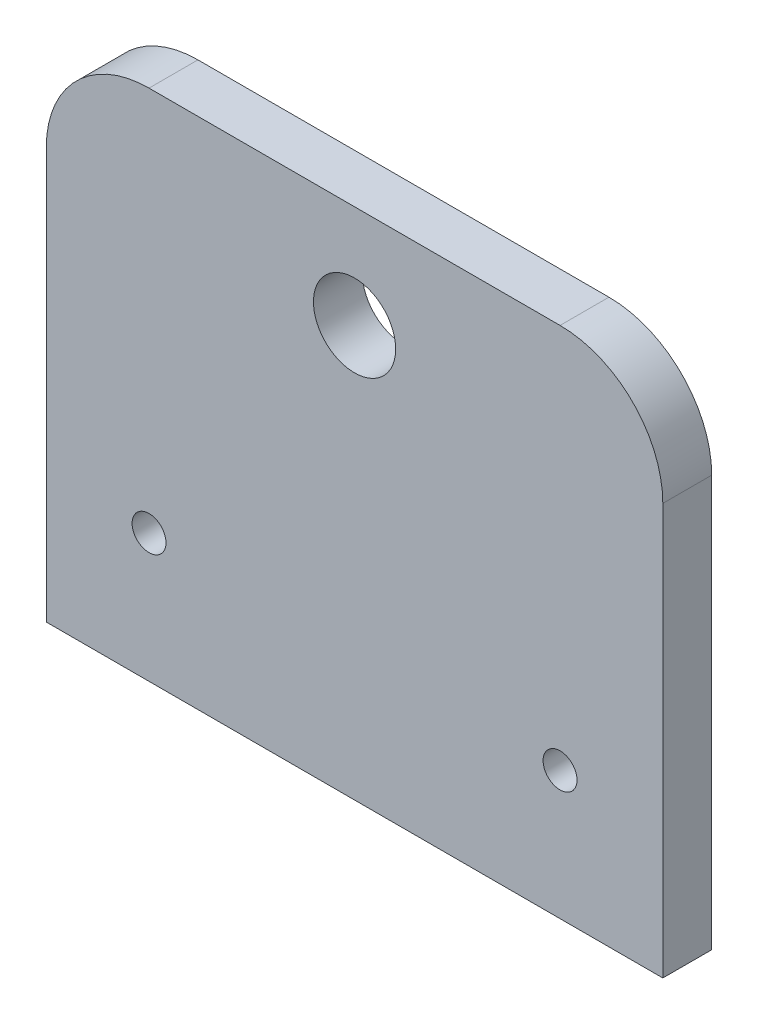
from build123d import *

# Parameters (mm, degrees)
SKETCH1_W           = 60
SKETCH1_H           = 50
BOSS_EXTRUDE1_DEPTH = 4.76
SKETCH2_R           = 1.65
SKETCH2_R_2         = 4
CUT_EXTRUDE1_DEPTH  = 79.247412737
FILLET1_R           = 10


with BuildPart() as part:
    # Sketch1 → Boss-Extrude1 (new body)
    with BuildSketch(Plane.XY):
        with Locations((30, 25)):
            Rectangle(SKETCH1_W, SKETCH1_H)
    extrude(amount=BOSS_EXTRUDE1_DEPTH)

    # Sketch2 → Cut-Extrude1 (cut, through all)
    with BuildSketch(Plane.XY.offset(4.76)):
        with Locations((10, 12.5)):
            Circle(SKETCH2_R)
        with Locations((50, 12.5)):
            Circle(SKETCH2_R)
        with Locations((30, 40)):
            Circle(SKETCH2_R_2)
    extrude(amount=-CUT_EXTRUDE1_DEPTH, mode=Mode.SUBTRACT)

    # Fillet1
    fillet1_edges = [part.edges().sort_by_distance(p)[0] for p in [
        (60, 50, 2.38),
        (0, 50, 2.38),
    ]]
    fillet(fillet1_edges, radius=FILLET1_R)


solid = part.part
